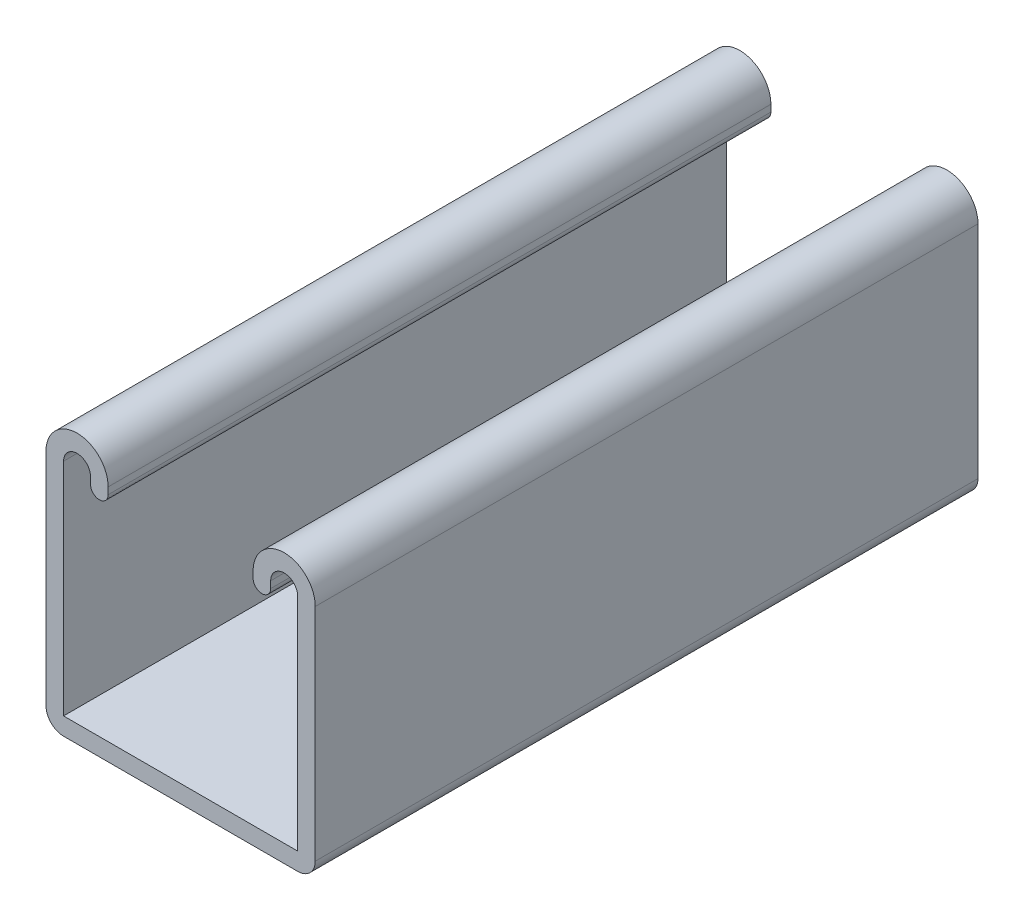
from build123d import *

# Parameters (mm, degrees)
BASE_EXTRUDE_DEPTH = 101.6
HOLE1_START        = -18.034
HOLE1_OUTLINE_R    = 7.14375
HOLE1_DEPTH        = 2.6924
LPATTERN1_COUNT    = 2
LPATTERN1_PITCH    = 47.625


# Read off the part's stored shape, not the designer's step: Hole1
with BuildPart() as part:
    # Sketch1 → Base-Extrude (new body)
    with BuildSketch(Plane.XY):
        with BuildLine():
            Line((-20.6375, 18.4785), (-20.6375, -15.3416))
            ThreePointArc((-20.6375, -15.3416), (-19.848914298, -17.245414298), (-17.9451, -18.034))
            Line((-17.9451, -18.034), (17.9451, -18.034))
            ThreePointArc((17.9451, -18.034), (19.848914298, -17.245414298), (20.6375, -15.3416))
            Line((20.6375, -15.3416), (20.6375, 18.4785))
            ThreePointArc((20.6375, 18.4785), (15.875, 23.241), (11.1125, 18.4785))
            Line((11.1125, 18.4785), (11.1125, 17.44345))
            ThreePointArc((11.1125, 17.44345), (12.4587, 16.09725), (13.8049, 17.44345))
            Line((13.8049, 17.44345), (13.8049, 18.4785))
            ThreePointArc((13.8049, 18.4785), (15.875, 20.5486), (17.9451, 18.4785))
            Line((17.9451, 18.4785), (17.9451, -15.3416))
            Line((17.9451, -15.3416), (-17.9451, -15.3416))
            Line((-17.9451, -15.3416), (-17.9451, 18.4785))
            ThreePointArc((-17.9451, 18.4785), (-15.875, 20.5486), (-13.8049, 18.4785))
            Line((-13.8049, 18.4785), (-13.8049, 17.44345))
            ThreePointArc((-13.8049, 17.44345), (-12.4587, 16.09725), (-11.1125, 17.44345))
            Line((-11.1125, 17.44345), (-11.1125, 18.4785))
            ThreePointArc((-11.1125, 18.4785), (-15.875, 23.241), (-20.6375, 18.4785))
        make_face()
    extrude(amount=BASE_EXTRUDE_DEPTH)

    # Hole1 outline → Hole1 (cut)
    with BuildSketch(Plane(origin=(0, 0, 0), x_dir=(1, 0, 0), z_dir=(0, 1, 0)).offset(HOLE1_START)):
        with Locations((0, -23.8125)):
            Circle(HOLE1_OUTLINE_R)
    hole1 = extrude(amount=HOLE1_DEPTH, mode=Mode.SUBTRACT)

    # LPattern1: Hole1 ×2
    with Locations(*[(0, 0, i * LPATTERN1_PITCH) for i in range(1, LPATTERN1_COUNT)]):
        add(hole1, mode=Mode.SUBTRACT)


solid = part.part
